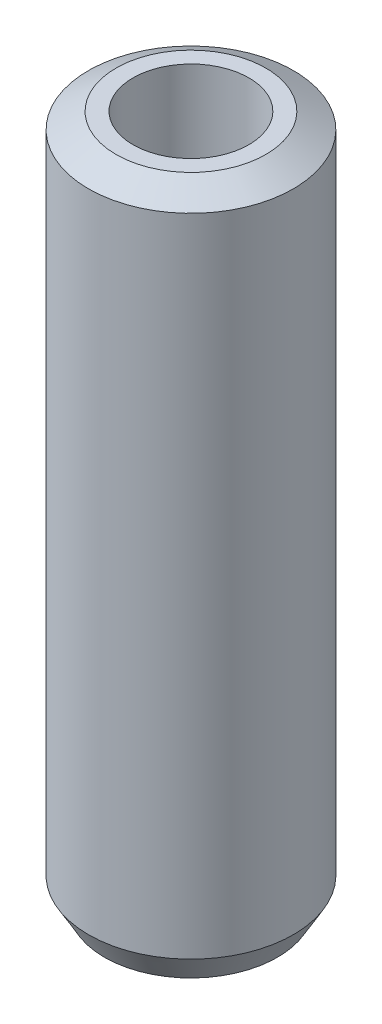
from build123d import *
from OCP.BRepFilletAPI import BRepFilletAPI_MakeChamfer

# Parameters (mm, degrees)
SKETCH1_R           = 37.5
BOSS_EXTRUDE1_DEPTH = 252.29037869
SKETCH2_R           = 21.20431745
CUT_EXTRUDE1_DEPTH  = 258.804063543
CHAMFER1_SIZE       = 5.824424741
CHAMFER1_SIZE2      = 10.088199576


with BuildPart() as part:
    # Sketch1 → Boss-Extrude1 (new body)
    with BuildSketch(Plane(origin=(0, 0, 0), x_dir=(1, 0, 0), z_dir=(0, 1, 0))):
        Circle(SKETCH1_R)
    extrude(amount=BOSS_EXTRUDE1_DEPTH)

    # Sketch2 → Cut-Extrude1 (cut, through all)
    with BuildSketch(Plane(origin=(0, 0, 0), x_dir=(1, 0, 0), z_dir=(0, 1, 0))):
        Circle(SKETCH2_R)
    extrude(amount=CUT_EXTRUDE1_DEPTH, mode=Mode.SUBTRACT)

    # Chamfer1: one chamfer whose edges measure the first distance from different faces: ONE call of the kernel's chamfer builder (chamfer() names one face for all edges)
    chamfer1_edges_1 = [part.edges().sort_by_distance(p)[0] for p in [
        (-37.5, 252.29037869, 0),
    ]]
    chamfer1_side_1 = [part.faces().sort_by_distance(p)[0] for p in [
        (-37.5, 126.145189345, 0),
    ]]
    chamfer1_edges_2 = [part.edges().sort_by_distance(p)[0] for p in [
        (-37.5, 0, 0),
    ]]
    chamfer1_side_2 = [part.faces().sort_by_distance(p)[0] for p in [
        (-36.439339828, 0, 0),
    ]]
    chamfer1 = BRepFilletAPI_MakeChamfer(part.part.solid().wrapped)
    for e in chamfer1_edges_1:
        chamfer1.Add(CHAMFER1_SIZE, CHAMFER1_SIZE2, e.wrapped, chamfer1_side_1[0].wrapped)  # the first distance lies on this face
    for e in chamfer1_edges_2:
        chamfer1.Add(CHAMFER1_SIZE, CHAMFER1_SIZE2, e.wrapped, chamfer1_side_2[0].wrapped)  # the first distance lies on this face
    add(Compound.cast(chamfer1.Shape()), mode=Mode.REPLACE)


solid = part.part
